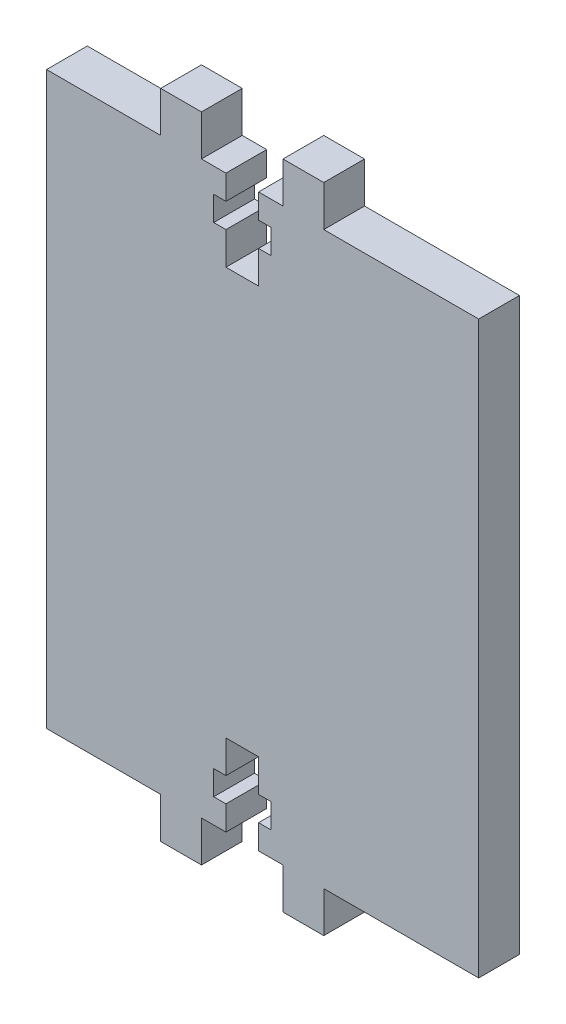
from build123d import *

# Parameters (mm, degrees)
BOSS_EXTRU_1_DEPTH = 5


with BuildPart() as part:
    # Esquisse2 → Boss.-Extru.1 (new body)
    with BuildSketch(Plane.XY):
        Polygon((-24, 0), (-10, 0), (-10, -5), (-5, -5), (-5, 0), (-2, 0), (-2, 3), (-3.5, 3), (-3.5, 6), (-2, 6), (-2, 10), (2, 10), (2, 6), (3.5, 6), (3.5, 3), (2, 3), (2, 0), (5, 0), (5, -5), (10, -5), (10, 0), (29, 0), (29, 70), (10, 70), (10, 75), (5, 75), (5, 70), (2, 70), (2, 67), (3.5, 67), (3.5, 64), (2, 64), (2, 60), (-2, 60), (-2, 64), (-3.5, 64), (-3.5, 67), (-2, 67), (-2, 70), (-5, 70), (-5, 75), (-10, 75), (-10, 70), (-24, 70), align=None)
    extrude(amount=BOSS_EXTRU_1_DEPTH)


solid = part.part
